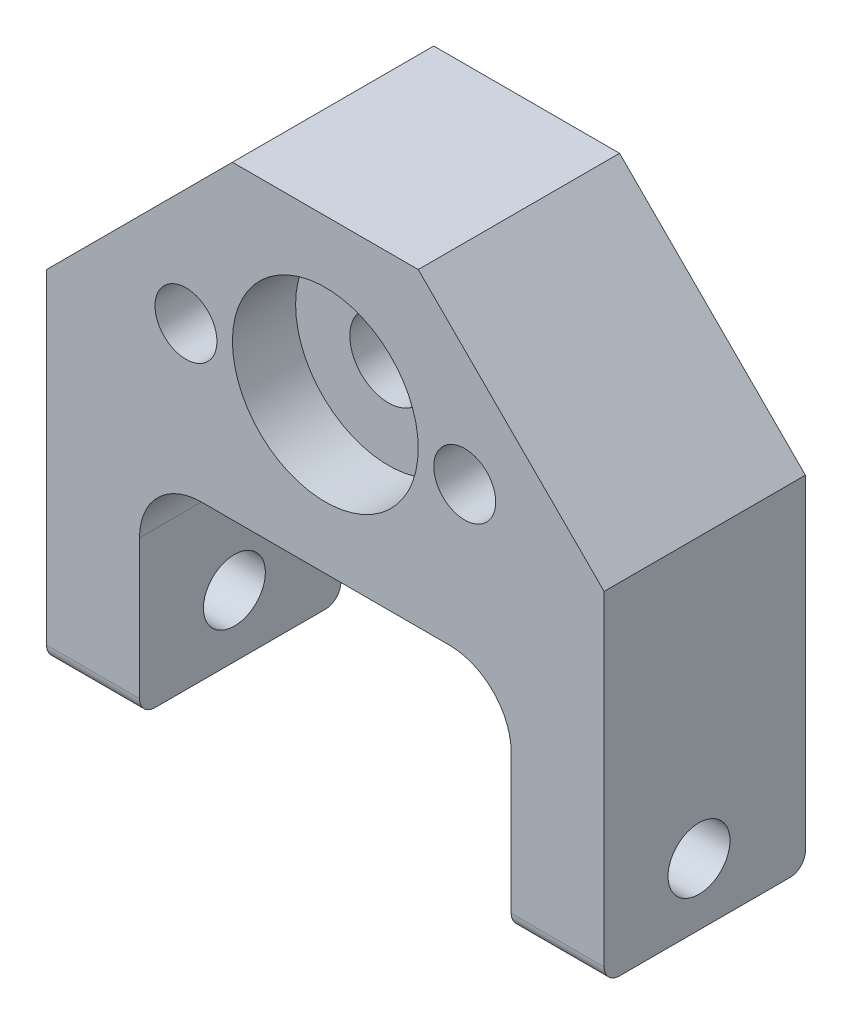
from build123d import *

# Parameters (mm, degrees)
SKETCH1_W                      = 57.15
SKETCH1_H                      = 31.75
BOSS_EXTRUDE1_DEPTH            = 20.6375
SKETCH2_R                      = 11.1125
CUT_EXTRUDE1_DEPTH             = 6.985
SKETCH3_R                      = 8.255
CUT_EXTRUDE2_DEPTH             = 2.413
SKETCH4_R                      = 3.96875
CUT_EXTRUDE3_DEPTH             = 35.56692943
CUT_EXTRUDE4_START             = -4.7625
SKETCH6_R                      = 9.525
CUT_EXTRUDE4_DEPTH             = 30.80442943
SKETCH7_W                      = 9.525
SKETCH7_H                      = 20.6375
BOSS_EXTRUDE2_DEPTH            = 22.225
SKETCH9_R                      = 3.175
CUT_EXTRUDE5_DEPTH             = 72.719166938
FILLET1_R                      = 6.35
F_1_4_0_2500_DOWEL_HOLE1_D     = 6.35
F_1_4_0_2500_DOWEL_HOLE1_DEPTH = 9.652
F_1_4_0_2500_DOWEL_HOLE1_TIP   = 1.907732465
FILLET3_R                      = 1.5875
CHAMFER1_SIZE                  = 19.05


with BuildPart() as part:
    # Sketch1 → Boss-Extrude1 (new body)
    with BuildSketch(Plane.XY):
        Rectangle(SKETCH1_W, SKETCH1_H)
    extrude(amount=BOSS_EXTRUDE1_DEPTH)

    # Sketch2 → Cut-Extrude1 (cut)
    with BuildSketch(Plane(origin=(0, 0, 0), x_dir=(-1, 0, 0), z_dir=(0, 0, -1))):
        Circle(SKETCH2_R)
    extrude(amount=-CUT_EXTRUDE1_DEPTH, mode=Mode.SUBTRACT)

    # Sketch3 → Cut-Extrude2 (cut)
    with BuildSketch(Plane(origin=(0, 0, 6.985), x_dir=(-1, 0, 0), z_dir=(0, 0, -1))):
        Circle(SKETCH3_R)
    extrude(amount=-CUT_EXTRUDE2_DEPTH, mode=Mode.SUBTRACT)

    # Sketch4 → Cut-Extrude3 (cut, through all)
    with BuildSketch(Plane(origin=(0, 0, 9.398), x_dir=(-1, 0, 0), z_dir=(0, 0, -1))):
        Circle(SKETCH4_R)
    extrude(amount=-CUT_EXTRUDE3_DEPTH, mode=Mode.SUBTRACT)

    # Sketch6 → Cut-Extrude4 (cut, through all)
    with BuildSketch(Plane(origin=(0, 0, 9.398), x_dir=(-1, 0, 0), z_dir=(0, 0, -1)).offset(CUT_EXTRUDE4_START)):
        Circle(SKETCH6_R)
    extrude(amount=-CUT_EXTRUDE4_DEPTH, mode=Mode.SUBTRACT)

    # Sketch7 → Boss-Extrude2 (add)
    with BuildSketch(Plane.XZ.offset(15.875)):
        with Locations((-23.8125, 10.31875)):
            Rectangle(SKETCH7_W, SKETCH7_H)
        with Locations((23.8125, 10.31875)):
            Rectangle(SKETCH7_W, SKETCH7_H)
    extrude(amount=BOSS_EXTRUDE2_DEPTH)

    # Sketch9 → Cut-Extrude5 (cut, through all)
    with BuildSketch(Plane(origin=(28.575, 0, 0), x_dir=(0, 0, -1), z_dir=(1, 0, 0))):
        with Locations((-10.909520599, -31.75)):
            Circle(SKETCH9_R)
    extrude(amount=-CUT_EXTRUDE5_DEPTH, mode=Mode.SUBTRACT)

    # Fillet1
    fillet1_edges = [part.edges().sort_by_distance(p)[0] for p in [
        (19.05, -15.875, 10.31875),
        (-19.05, -15.875, 10.31875),
    ]]
    fillet(fillet1_edges, radius=FILLET1_R)

    # 1/4 (0.2500) Dowel Hole1
    with Locations(Plane.XY.offset(20.6375)):
        with Locations((-14.2875, -0.8255), (14.2875, -0.80518)):
            Hole(F_1_4_0_2500_DOWEL_HOLE1_D / 2, depth=F_1_4_0_2500_DOWEL_HOLE1_DEPTH)
            with Locations((0, 0, -(F_1_4_0_2500_DOWEL_HOLE1_DEPTH + F_1_4_0_2500_DOWEL_HOLE1_TIP / 2))):  # 118° drill point
                Cone(0, F_1_4_0_2500_DOWEL_HOLE1_D / 2, F_1_4_0_2500_DOWEL_HOLE1_TIP, mode=Mode.SUBTRACT)

    # Fillet3
    fillet3_edges = [part.edges().sort_by_distance(p)[0] for p in [
        (23.8125, -38.1, 0),
        (23.8125, -38.1, 20.6375),
        (-23.8125, -38.1, 20.6375),
        (-23.8125, -38.1, 0),
    ]]
    fillet(fillet3_edges, radius=FILLET3_R)

    # Chamfer1
    chamfer1_edges = [part.edges().sort_by_distance(p)[0] for p in [
        (28.575, 15.875, 10.31875),
        (-28.575, 15.875, 10.31875),
    ]]
    chamfer(chamfer1_edges, length=CHAMFER1_SIZE)


solid = part.part
